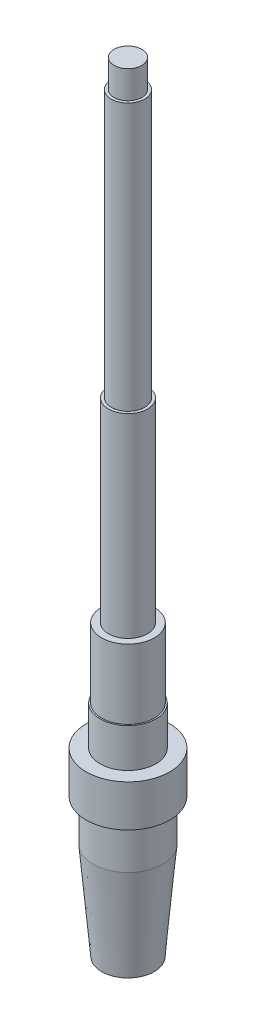
from build123d import *

# Parameters (mm, degrees)
WYTNIJ_WYCI_GNI_CIE1_DEPTH = 7
WYTNIJ_WYCI_GNI_CIE2_DEPTH = 3
OTW_R_GWINTOWANY_M81_D     = 6.8
OTW_R_GWINTOWANY_M81_DEPTH = 22.25
OTW_R_GWINTOWANY_M81_TIP   = 2.042926105


with BuildPart() as part:
    # Szkic1 → Obrót1 (revolve)
    with BuildSketch(Plane.XY):
        Polygon((0, -140), (9.437896777, -140), (12.5, -105), (12.5, -90), (15, -90), (15, -75), (10, -75), (10, -61), (9.5, -61), (9.5, -36), (7, -36), (7, 34), (6, 34), (6, 130), (5, 130), (5, 140), (0, 140), align=None)
    revolve(axis=Axis((0, 140, 0), (0, -1, 0)))

    # Szkic2 → Wytnij-wyciągnięcie1 (cut)
    with BuildSketch(Plane(origin=(0, 0, -12.5), x_dir=(-1, 0, 0), z_dir=(0, 0, -1))):
        with BuildLine():
            Line((-3, -140), (-3, -110))
            ThreePointArc((-3, -110), (0, -107), (3, -110))
            Line((3, -110), (3, -140))
            ThreePointArc((3, -140), (0, -143), (-3, -140))
        make_face()
    extrude(amount=-WYTNIJ_WYCI_GNI_CIE1_DEPTH, mode=Mode.SUBTRACT)

    # Szkic3 → Wytnij-wyciągnięcie2 (cut)
    with BuildSketch(Plane(origin=(0, 0, -7), x_dir=(-1, 0, 0), z_dir=(0, 0, -1))):
        with BuildLine():
            Line((2.5, 21.5), (2.5, -23.5))
            ThreePointArc((2.5, -23.5), (0, -26), (-2.5, -23.5))
            Line((-2.5, -23.5), (-2.5, 21.5))
            ThreePointArc((-2.5, 21.5), (0, 24), (2.5, 21.5))
        make_face()
    extrude(amount=-WYTNIJ_WYCI_GNI_CIE2_DEPTH, mode=Mode.SUBTRACT)

    # Otwór gwintowany M81
    with Locations(Plane(origin=(0, -140, 0), x_dir=(-1, 0, 0), z_dir=(0, -1, 0))):
        with Locations((0, 0)):
            Hole(OTW_R_GWINTOWANY_M81_D / 2, depth=OTW_R_GWINTOWANY_M81_DEPTH)
            with Locations((0, 0, -(OTW_R_GWINTOWANY_M81_DEPTH + OTW_R_GWINTOWANY_M81_TIP / 2))):  # 118° drill point
                Cone(0, OTW_R_GWINTOWANY_M81_D / 2, OTW_R_GWINTOWANY_M81_TIP, mode=Mode.SUBTRACT)


solid = part.part
